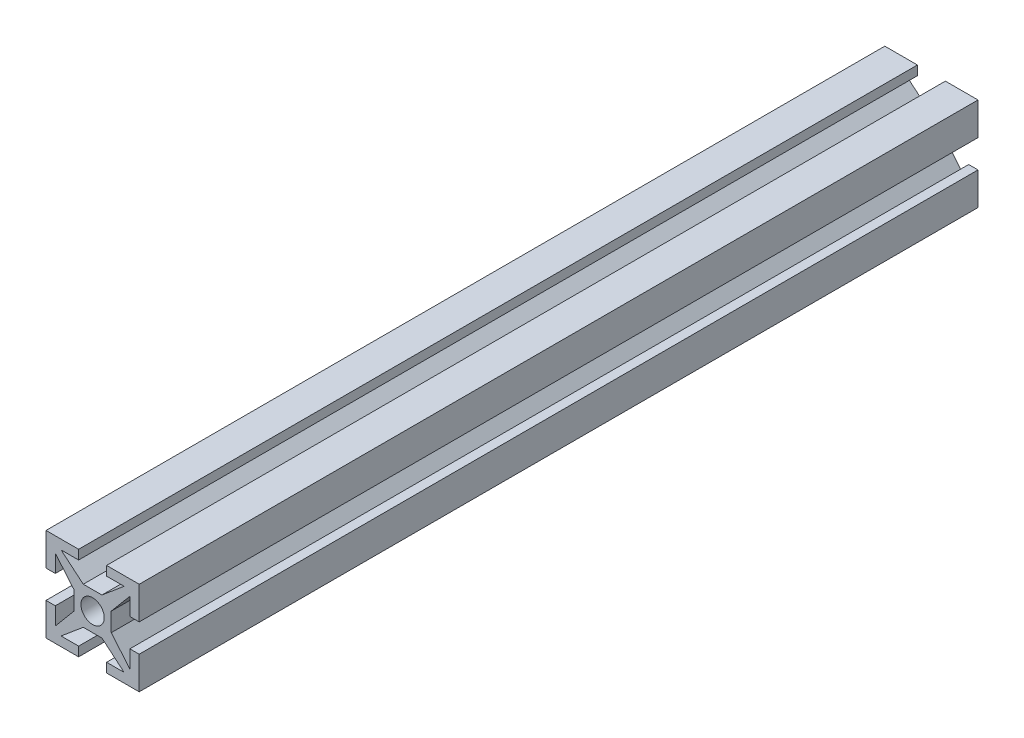
from build123d import *

# Parameters (mm, degrees)
ESQUISSE2_R          = 1.25
MAIN_EXTRUSION_DEPTH = 90


with BuildPart() as part:
    # Esquisse2 → Main Extrusion (new body)
    with BuildSketch(Plane.XY):
        Polygon((-1, -2), (1, -2), (3.383507185, -4), (1.5, -4), (1.5, -5), (5, -5), (5, -1.5), (4, -1.5), (4, -3.383507185), (2, -1), (2, 1), (4, 3.383507185), (4, 1.5), (5, 1.5), (5, 5), (1.5, 5), (1.5, 4), (3.383507185, 4), (1, 2), (-1, 2), (-3.383507185, 4), (-1.5, 4), (-1.5, 5), (-5, 5), (-5, 1.5), (-4, 1.5), (-4, 3.383507185), (-2, 1), (-2, -1), (-4, -3.383507185), (-4, -1.5), (-5, -1.5), (-5, -5), (-1.5, -5), (-1.5, -4), (-3.383507185, -4), align=None)
        Circle(ESQUISSE2_R, mode=Mode.SUBTRACT)
    extrude(amount=MAIN_EXTRUSION_DEPTH)


solid = part.part
